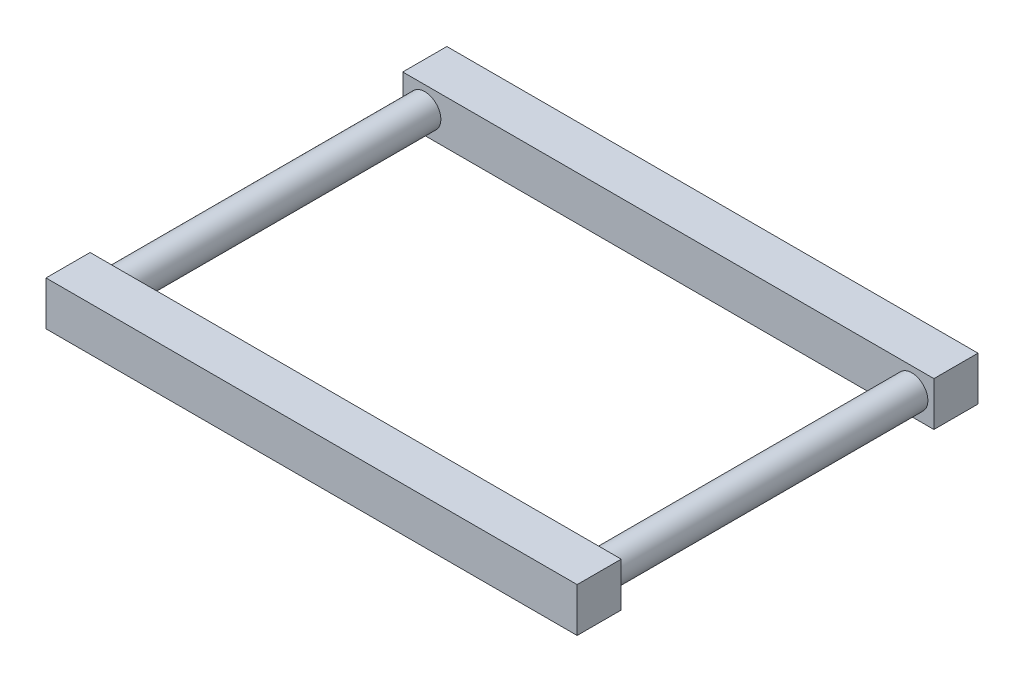
from build123d import *

# Parameters (mm, degrees)
BOSS_EXTRUDE1_DEPTH      = 27.94
BOSS_EXTRUDE1_DEPTH_BACK = 27.94
SKETCH3_W                = 673.1
SKETCH3_H                = 55.88
SKETCH3_7_W              = 20.32
SKETCH3_7_H              = 396.24


with BuildPart() as part:
    # Sketch2 → Revolve1 (revolve)
    with BuildSketch(Plane(origin=(0, 0, 0), x_dir=(1, 0, 0), z_dir=(0, 1, 0))):
        Polygon((0, -198.12), (0, 0), (0, 198.12), (-20.32, 198.12), (-20.32, -198.12), align=None)
    revolve(axis=Axis((0, 0, 0), (0, 0, 1)))

    # Sketch3 → Boss-Extrude1 (add, two sides: drawn at the far end of the back side and taken through both)
    with BuildSketch(Plane(origin=(0, 0, 0), x_dir=(1, 0, 0), z_dir=(0, 1, 0)).offset(-BOSS_EXTRUDE1_DEPTH_BACK)):
        with Locations((308.61, -226.06)):
            Rectangle(SKETCH3_W, SKETCH3_H)
        with Locations((308.61, 226.06)):
            Rectangle(SKETCH3_W, SKETCH3_H)
    extrude(amount=BOSS_EXTRUDE1_DEPTH + BOSS_EXTRUDE1_DEPTH_BACK)

    # Sketch3<7> → Revolve3 (revolve)
    with BuildSketch(Plane(origin=(0, 0, 0), x_dir=(1, 0, 0), z_dir=(0, 1, 0))):
        with Locations((627.38, 0)):
            Rectangle(SKETCH3_7_W, SKETCH3_7_H)
    revolve(axis=Axis((617.22, 0, 0), (0, 0, 1)))


solid = part.part
